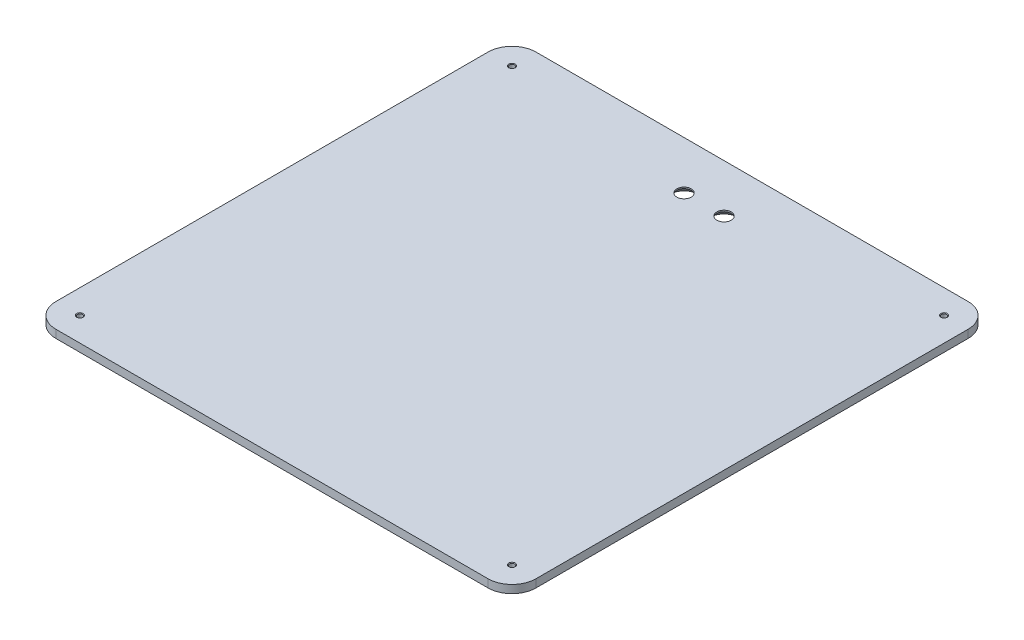
from build123d import *

# Parameters (mm, degrees)
ESQUISSE1_W                                 = 300
ESQUISSE1_H                                 = 300
T_LE_DE_BASE_PLI_E1_DEPTH                   = 5
FRAISAGE_POUR_VIS_T_TE_FRAIS_E_M81_AT_COUNT = 2
FRAISAGE_POUR_VIS_T_TE_FRAIS_E_M81_AT_PITCH = 25
TROU_TARAUD_M41_D                           = 3.3
TROU_TARAUD_M41_CSINK_D                     = 4.05
TROU_TARAUD_M41_CSINK_ANGLE                 = 90
CONG_1_R                                    = 15


# Sheet-metal steps are written as plain solids
with BuildPart() as part:
    # Esquisse1 → Tôle de base pliée1 (new body)
    with BuildSketch(Plane(origin=(0, 0, 0), x_dir=(1, 0, 0), z_dir=(0, 1, 0))):
        Rectangle(ESQUISSE1_W, ESQUISSE1_H)
    extrude(amount=-T_LE_DE_BASE_PLI_E1_DEPTH)

    # Esquisse3 → Fraisage pour vis à tête fraisée M81 (revolve, cut)
    with BuildSketch(Plane(origin=(12.5, -5, -120), x_dir=(0, 0, -1), z_dir=(1, 0, 0))):
        Polygon((0, 0), (0, 5), (4.5, 5), (4.5, 4.15), (8.65, 0), align=None)
    fraisage_pour_vis_t_te_frais_e_m81 = revolve(axis=Axis((12.5, -11.35, -120), (0, 1, 0)), mode=Mode.SUBTRACT)

    # Fraisage pour vis à tête fraisée M81 at: Fraisage pour vis à tête fraisée M81 ×2
    with Locations(*[(-i * FRAISAGE_POUR_VIS_T_TE_FRAIS_E_M81_AT_PITCH, 0, 0) for i in range(1, FRAISAGE_POUR_VIS_T_TE_FRAIS_E_M81_AT_COUNT)]):
        add(fraisage_pour_vis_t_te_frais_e_m81, mode=Mode.SUBTRACT)

    # Trou taraudé M41 (through all)
    with Locations(Plane(origin=(0, 0, 0), x_dir=(1, 0, 0), z_dir=(0, 1, 0))):
        with Locations((135, -135), (-135, -135), (-135, 135), (135, 135)):
            CounterSinkHole(TROU_TARAUD_M41_D / 2, TROU_TARAUD_M41_CSINK_D / 2, counter_sink_angle=TROU_TARAUD_M41_CSINK_ANGLE)

    # Congé1
    cong_1_edges = [part.edges().sort_by_distance(p)[0] for p in [
        (-150, -2.5, -150),
        (150, -2.5, -150),
        (150, -2.5, 150),
        (-150, -2.5, 150),
    ]]
    fillet(cong_1_edges, radius=CONG_1_R)


solid = part.part
